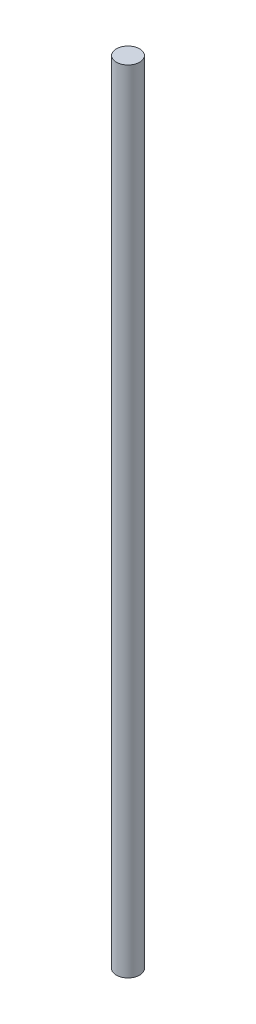
from build123d import *

# Parameters (mm, degrees)
SKETCH1_R           = 5
BOSS_EXTRUDE1_DEPTH = 340


with BuildPart() as part:
    # Sketch1 → Boss-Extrude1 (new body)
    with BuildSketch(Plane(origin=(0, 0, 0), x_dir=(1, 0, 0), z_dir=(0, 1, 0))):
        with Locations((1.328390805, 0)):
            Circle(SKETCH1_R)
    extrude(amount=BOSS_EXTRUDE1_DEPTH)


solid = part.part
